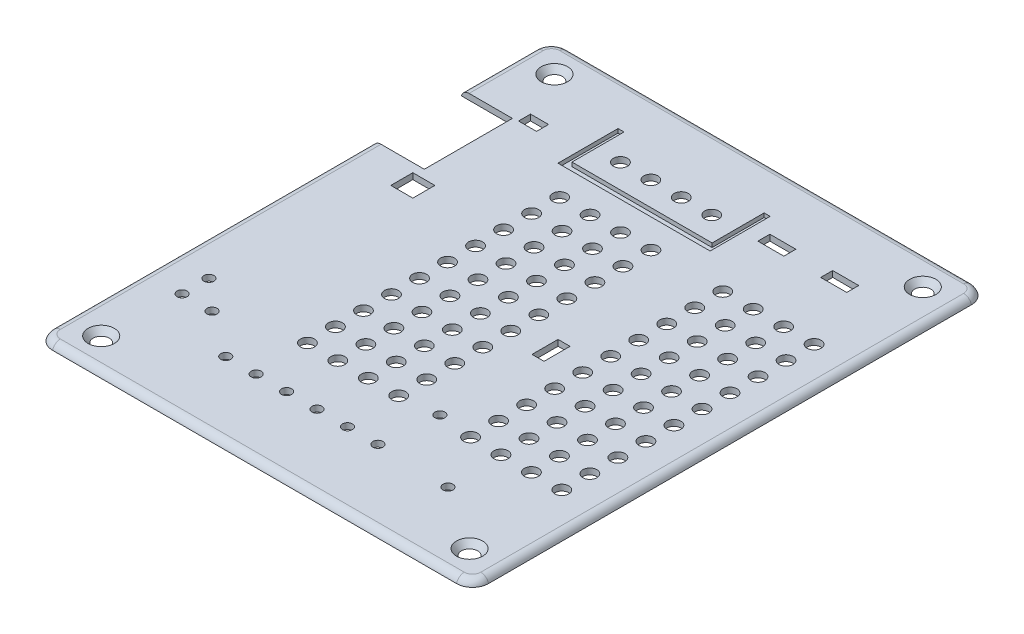
from build123d import *

# Parameters (mm, degrees)
SKICA1_W                 = 108.89
SKICA1_H                 = 128.6
P_IDAT_VYSUNUT_M1_DEPTH  = 1.5
ZAOBLIT1_R               = 4
ZAOBLIT2_R               = 2
SKICA2_R                 = 1.6
ODEBRAT_VYSUNUT_M1_DEPTH = 3
LINPOLE1_COUNT           = 2
LINPOLE1_PITCH           = 113.2
LINPOLE1_COUNT_DIR2      = 2
LINPOLE1_PITCH_DIR2      = 92
ZKOSEN_1_SIZE            = 2
ZKOSEN_1_SIZE_2          = 1.678199262
SKICA3_R                 = 1.75
ODEBRAT_VYSUNUT_M3_DEPTH = 4
LINPOLE3_COUNT           = 10
LINPOLE3_PITCH           = 7
LINPOLE3_COUNT_DIR2      = 4
LINPOLE3_PITCH_DIR2      = 7.6
SKICA3_3_R               = 1.75
ODEBRAT_VYSUNUT_M4_DEPTH = 4
LINPOLE4_COUNT           = 10
LINPOLE4_PITCH           = 7
LINPOLE4_COUNT_DIR2      = 4
LINPOLE4_PITCH_DIR2      = 7.6
SKICA3_4_R               = 1.75
ODEBRAT_VYSUNUT_M5_DEPTH = 10
LINPOLE5_COUNT           = 4
LINPOLE5_PITCH           = 7.6
SKICA4_R                 = 1.25
SKICA4_W                 = 6.5
SKICA4_H                 = 3
SKICA4_W_2               = 3
SKICA4_H_2               = 6.5
ODEBRAT_VYSUNUT_M6_DEPTH = 10
SKICA5_R                 = 1.25
ODEBRAT_VYSUNUT_M7_DEPTH = 10
LINPOLE6_COUNT           = 6
LINPOLE6_PITCH           = 7.6
SKICA6_W                 = 5.5
SKICA6_H                 = 5.5
SKICA6_W_2               = 4.5
SKICA6_H_2               = 3
SKICA6_W_3               = 21.51334333
SKICA6_H_3               = 22
ODEBRAT_VYSUNUT_M8_DEPTH = 10
SKICA7_W                 = 35
SKICA7_H                 = 2
ODEBRAT_VYSUNUT_M9_DEPTH = 1


with BuildPart() as part:
    # Skica1 → Přidat vysunutím1 (new body)
    with BuildSketch(Plane(origin=(0, 0, 0), x_dir=(1, 0, 0), z_dir=(0, 1, 0))):
        Rectangle(SKICA1_W, SKICA1_H)
    extrude(amount=P_IDAT_VYSUNUT_M1_DEPTH)

    # Zaoblit1
    zaoblit1_edges = [part.edges().sort_by_distance(p)[0] for p in [
        (54.445, 0.75, 64.3),
        (-54.445, 0.75, 64.3),
        (-54.445, 0.75, -64.3),
        (54.445, 0.75, -64.3),
    ]]
    fillet(zaoblit1_edges, radius=ZAOBLIT1_R)

    # Zaoblit2
    # the kernel refuses this fillet: 2 mm, written as the material it takes off along each edge
    with BuildSketch(Plane(origin=(50.445, 1.5, 60.3), x_dir=(0, 0, 1), z_dir=(-1, 0, 0))) as zaoblit2_piece_1:
        with BuildLine():
            CenterArc((2.063508327, -2), ZAOBLIT2_R, 14.477512186, 75.522487814)
            Line((2.063508327, 0), (2.063508327, 0.04))
            Line((2.063508327, 0.04), (4, 0.04))
            Line((4, 0.04), (4.04, 0))
            ThreePointArc((4.04, 0), (4.04, -0.75), (4.038729833, -1.49))
            Line((4.038729833, -1.49), (4, -1.5))
        make_face()
    revolve(axis=Axis((50.445, 1.5, 60.3), (0, 1, 0)), revolution_arc=90, mode=Mode.SUBTRACT)
    with BuildSketch(Plane(origin=(-50.445, 1.5, 64.3), x_dir=(0, -1, 0), z_dir=(1, 0, 0))) as zaoblit2_piece_2:
        with BuildLine():
            CenterArc((2, 1.936491673), ZAOBLIT2_R, 180, 75.522487814)
            Line((0, 1.936491673), (-0.04, 1.936491673))
            Line((-0.04, 1.936491673), (-0.04, 0))
            Line((-0.04, 0), (0, -0.04))
            ThreePointArc((0, -0.04), (0.75, -0.04), (1.49, -0.038729833))
            Line((1.49, -0.038729833), (1.5, 0))
        make_face()
    extrude(amount=100.89, mode=Mode.SUBTRACT)
    with BuildSketch(Plane(origin=(-50.445, 1.5, 60.3), x_dir=(0, 0, 1), z_dir=(1, 0, 0))) as zaoblit2_piece_3:
        with BuildLine():
            CenterArc((2.063508327, 2), ZAOBLIT2_R, 270, 75.522487814)
            Line((2.063508327, 0), (2.063508327, -0.04))
            Line((2.063508327, -0.04), (4, -0.04))
            Line((4, -0.04), (4.04, 0))
            ThreePointArc((4.04, 0), (4.04, 0.75), (4.038729833, 1.49))
            Line((4.038729833, 1.49), (4, 1.5))
        make_face()
    revolve(axis=Axis((-50.445, 1.5, 60.3), (0, -1, 0)), revolution_arc=90, mode=Mode.SUBTRACT)
    with BuildSketch(Plane(origin=(-54.445, 1.5, -60.3), x_dir=(1, 0, 0), z_dir=(0, 0, 1)), Plane(origin=(54.445, 1.5, 60.3), x_dir=(-1, 0, 0), z_dir=(0, 0, -1))) as zaoblit2_piece_4:
        with BuildLine():
            CenterArc((1.936491673, -2), ZAOBLIT2_R, 90, 75.522487814)
            Line((0, -1.5), (-0.038729833, -1.49))
            ThreePointArc((-0.038729833, -1.49), (-0.04, -0.75), (-0.04, 0))
            Line((-0.04, 0), (0, 0.04))
            Line((0, 0.04), (1.936491673, 0.04))
            Line((1.936491673, 0.04), (1.936491673, 0))
        make_face()
    extrude(amount=120.6, mode=Mode.SUBTRACT)
    with BuildSketch(Plane(origin=(-50.445, 1.5, -60.3), x_dir=(0, 0, -1), z_dir=(1, 0, 0))) as zaoblit2_piece_5:
        with BuildLine():
            CenterArc((2.063508327, -2), ZAOBLIT2_R, 14.477512186, 75.522487814)
            Line((4, -1.5), (4.038729833, -1.49))
            ThreePointArc((4.038729833, -1.49), (4.04, -0.75), (4.04, 0))
            Line((4.04, 0), (4, 0.04))
            Line((4, 0.04), (2.063508327, 0.04))
            Line((2.063508327, 0.04), (2.063508327, 0))
        make_face()
    revolve(axis=Axis((-50.445, 1.5, -60.3), (0, 1, 0)), revolution_arc=90, mode=Mode.SUBTRACT)
    with BuildSketch(Plane(origin=(50.445, 1.5, -64.3), x_dir=(0, 0, 1), z_dir=(-1, 0, 0))) as zaoblit2_piece_6:
        with BuildLine():
            CenterArc((1.936491673, -2), ZAOBLIT2_R, 90, 75.522487814)
            Line((0, -1.5), (-0.038729833, -1.49))
            ThreePointArc((-0.038729833, -1.49), (-0.04, -0.75), (-0.04, 0))
            Line((-0.04, 0), (0, 0.04))
            Line((0, 0.04), (1.936491673, 0.04))
            Line((1.936491673, 0.04), (1.936491673, 0))
        make_face()
    extrude(amount=100.89, mode=Mode.SUBTRACT)
    with BuildSketch(Plane(origin=(50.445, 1.5, -60.3), x_dir=(1, 0, 0), z_dir=(0, 0, 1))) as zaoblit2_piece_7:
        with BuildLine():
            CenterArc((2.063508327, -2), ZAOBLIT2_R, 14.477512186, 75.522487814)
            Line((4, -1.5), (4.038729833, -1.49))
            ThreePointArc((4.038729833, -1.49), (4.04, -0.75), (4.04, 0))
            Line((4.04, 0), (4, 0.04))
            Line((4, 0.04), (2.063508327, 0.04))
            Line((2.063508327, 0.04), (2.063508327, 0))
        make_face()
    revolve(axis=Axis((50.445, 1.5, -60.3), (0, 1, 0)), revolution_arc=90, mode=Mode.SUBTRACT)

    # Skica2 → Odebrat vysunutím1 (cut)
    with BuildSketch(Plane.XZ):
        with Locations(Location((-46, 56.6, 0), (0, 0, 270))):
            Circle(SKICA2_R)
    odebrat_vysunut_m1 = extrude(amount=-ODEBRAT_VYSUNUT_M1_DEPTH, mode=Mode.SUBTRACT)

    # LinPole1: Odebrat vysunut_m1 2 × 2
    with Locations(*[(j * LINPOLE1_PITCH_DIR2, 0, -i * LINPOLE1_PITCH) for i in range(LINPOLE1_COUNT) for j in range(LINPOLE1_COUNT_DIR2) if (i, j) != (0, 0)]):
        add(odebrat_vysunut_m1, mode=Mode.SUBTRACT)

    # Zkosení1
    # the kernel refuses this chamfer: 2, 1.678199262 mm, written as the material it takes off along each edge
    with BuildSketch(Plane(origin=(46, 1.5, 56.6), x_dir=(0, 0, -1), z_dir=(-1, 0, 0))) as zkosen_1_piece_1:
        Polygon((1.6, ZKOSEN_1_SIZE), (1.6 + ZKOSEN_1_SIZE_2, 0), (1.6, 0), align=None)
    revolve(axis=Axis((46, 1.5, 56.6), (0, -1, 0)), mode=Mode.SUBTRACT)
    with BuildSketch(Plane(origin=(46, 1.5, -56.6), x_dir=(0, 0, -1), z_dir=(-1, 0, 0))) as zkosen_1_piece_2:
        Polygon((1.6, ZKOSEN_1_SIZE), (1.6 + ZKOSEN_1_SIZE_2, 0), (1.6, 0), align=None)
    revolve(axis=Axis((46, 1.5, -56.6), (0, -1, 0)), mode=Mode.SUBTRACT)
    with BuildSketch(Plane(origin=(-46, 1.5, -56.6), x_dir=(0, 0, -1), z_dir=(-1, 0, 0))) as zkosen_1_piece_3:
        Polygon((1.6, ZKOSEN_1_SIZE), (1.6 + ZKOSEN_1_SIZE_2, 0), (1.6, 0), align=None)
    revolve(axis=Axis((-46, 1.5, -56.6), (0, -1, 0)), mode=Mode.SUBTRACT)
    with BuildSketch(Plane(origin=(-46, 1.5, 56.6), x_dir=(0, 0, -1), z_dir=(-1, 0, 0))) as zkosen_1_piece_4:
        Polygon((1.6, ZKOSEN_1_SIZE), (1.6 + ZKOSEN_1_SIZE_2, 0), (1.6, 0), align=None)
    revolve(axis=Axis((-46, 1.5, 56.6), (0, -1, 0)), mode=Mode.SUBTRACT)

    # Skica3 → Odebrat vysunutím3 (cut)
    with BuildSketch(Plane(origin=(0, 1.5, 0), x_dir=(1, 0, 0), z_dir=(0, 1, 0))):
        with Locations(Location((44.83, -32.38, 0), (0, 0, 270))):
            Circle(SKICA3_R)
    odebrat_vysunut_m3 = extrude(amount=-ODEBRAT_VYSUNUT_M3_DEPTH, mode=Mode.SUBTRACT)

    # LinPole3: Odebrat vysunut_m3 10 × 4
    with Locations(*[(-j * LINPOLE3_PITCH_DIR2, 0, -i * LINPOLE3_PITCH) for i in range(LINPOLE3_COUNT) for j in range(LINPOLE3_COUNT_DIR2) if (i, j) != (0, 0)]):
        add(odebrat_vysunut_m3, mode=Mode.SUBTRACT)

    # Skica3<3> → Odebrat vysunutím4 (cut)
    with BuildSketch(Plane(origin=(0, 1.5, 0), x_dir=(1, 0, 0), z_dir=(0, 1, 0))):
        with Locations(Location((4.08, -32.38, 0), (0, 0, 270))):
            Circle(SKICA3_3_R)
    odebrat_vysunut_m4 = extrude(amount=-ODEBRAT_VYSUNUT_M4_DEPTH, mode=Mode.SUBTRACT)

    # LinPole4: Odebrat vysunut_m4 10 × 4
    with Locations(*[(-j * LINPOLE4_PITCH_DIR2, 0, -i * LINPOLE4_PITCH) for i in range(LINPOLE4_COUNT) for j in range(LINPOLE4_COUNT_DIR2) if (i, j) != (0, 0)]):
        add(odebrat_vysunut_m4, mode=Mode.SUBTRACT)

    # Skica3<4> → Odebrat vysunutím5 (cut)
    with BuildSketch(Plane(origin=(0, 1.5, 0), x_dir=(1, 0, 0), z_dir=(0, 1, 0))):
        with Locations(Location((44.83, -32.38, 0), (0, 0, 270))):
            Circle(SKICA3_4_R)
        with Locations(Location((4.08, -32.38, 0), (0, 0, 270))):
            Circle(SKICA3_4_R)
        with Locations(Location((4.08, 45.8, 0), (0, 0, 270))):
            Circle(SKICA3_4_R)
    odebrat_vysunut_m5 = extrude(amount=-ODEBRAT_VYSUNUT_M5_DEPTH, mode=Mode.SUBTRACT)

    # LinPole5: Odebrat vysunutím5 ×4
    with Locations(*[(-i * LINPOLE5_PITCH, 0, 0) for i in range(1, LINPOLE5_COUNT)]):
        add(odebrat_vysunut_m5, mode=Mode.SUBTRACT)

    # Skica4 → Odebrat vysunutím6 (cut)
    with BuildSketch(Plane(origin=(0, 1.5, 0), x_dir=(1, 0, 0), z_dir=(0, 1, 0))):
        with Locations(Location((13.38, -31.4, 0), (0, 0, 270))):
            Circle(SKICA4_R)
        with Locations(Location((30, -46, 0), (0, 0, 270))):
            Circle(SKICA4_R)
        with Locations(Location((-45, -37.4, 0), (0, 0, 270))):
            Circle(SKICA4_R)
        with Locations(Location((-45, -30.7, 0), (0, 0, 270))):
            Circle(SKICA4_R)
        with Locations(Location((-37.52, -37.4, 0), (0, 0, 270))):
            Circle(SKICA4_R)
        with Locations((18.75, 47.4)):
            Rectangle(SKICA4_W, SKICA4_H)
        with Locations((34.45, 47.4)):
            Rectangle(SKICA4_W, SKICA4_H)
        with Locations((13.3, -3.55)):
            Rectangle(SKICA4_W_2, SKICA4_H_2)
    extrude(amount=-ODEBRAT_VYSUNUT_M6_DEPTH, mode=Mode.SUBTRACT)

    # Skica5 → Odebrat vysunutím7 (cut)
    with BuildSketch(Plane(origin=(0, 1.5, 0), x_dir=(1, 0, 0), z_dir=(0, 1, 0))):
        with Locations(Location((-26, -45.5, 0), (0, 0, 270))):
            Circle(SKICA5_R)
    odebrat_vysunut_m7 = extrude(amount=-ODEBRAT_VYSUNUT_M7_DEPTH, mode=Mode.SUBTRACT)

    # LinPole6: Odebrat vysunutím7 ×6
    with Locations(*[(i * LINPOLE6_PITCH, 0, 0) for i in range(1, LINPOLE6_COUNT)]):
        add(odebrat_vysunut_m7, mode=Mode.SUBTRACT)

    # Skica6 → Odebrat vysunutím8 (cut)
    with BuildSketch(Plane(origin=(0, 1.5, 0), x_dir=(1, 0, 0), z_dir=(0, 1, 0))):
        with Locations((-39.64, 14.87)):
            Rectangle(SKICA6_W, SKICA6_H)
        with Locations((-38.12, 43.5)):
            Rectangle(SKICA6_W_2, SKICA6_H_2)
        with Locations((-52.456671665, 30.8)):
            Rectangle(SKICA6_W_3, SKICA6_H_3)
    extrude(amount=-ODEBRAT_VYSUNUT_M8_DEPTH, mode=Mode.SUBTRACT)

    # Skica7 → Odebrat vysunutím9 (cut)
    with BuildSketch(Plane(origin=(0, 1.5, 0), x_dir=(1, 0, 0), z_dir=(0, 1, 0))):
        with Locations((-7.32, 38.8)):
            Rectangle(SKICA7_W, SKICA7_H)
        Polygon((-24.82, 37.8), (-24.82, 39.8), (-24.82, 52.8), (-26.32, 52.8), (-26.32, 37.8), align=None)
        Polygon((10.18, 52.8), (10.18, 39.8), (10.18, 37.8), (11.68, 37.8), (11.68, 52.8), align=None)
    extrude(amount=-ODEBRAT_VYSUNUT_M9_DEPTH, mode=Mode.SUBTRACT)


solid = part.part
